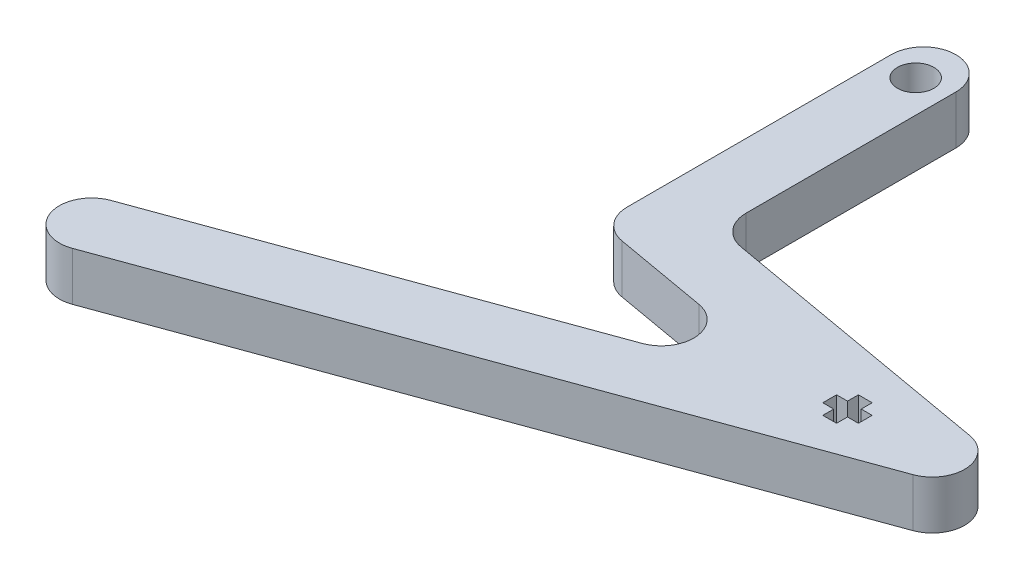
from build123d import *

# Parameters (mm, degrees)
SKETCH1_R           = 2.25
BOSS_EXTRUDE1_DEPTH = 6
FILLET1_R           = 4


with BuildPart() as part:
    # Sketch1 → Boss-Extrude1 (new body)
    with BuildSketch(Plane(origin=(0, 0, 0), x_dir=(1, 0, 0), z_dir=(0, 1, 0))):
        Polygon((-71.479040749, 49.048444694), (-71.479040749, 9.048444694), (-41.934808158, 3.838999364), (-107.848225403, -20.151522552), (-105.112064256, -27.669063518), (-11.142802178, 6.532950815), (-63.479040749, 15.761241744), (-63.479040749, 49.048444694), align=None)
        with Locations(Location((-67.479040749, 44.077475717, 0), (0, 0, 270))):
            Circle(SKETCH1_R, mode=Mode.SUBTRACT)
        Polygon((-38.433012349, 5.25170526), (-38.433012349, 3.55170526), (-37.083012349, 3.55170526), (-37.083012349, 2.20170526), (-35.383012349, 2.20170526), (-35.383012349, 3.55170526), (-34.033012349, 3.55170526), (-34.033012349, 5.25170526), (-35.383012349, 5.25170526), (-35.383012349, 6.60170526), (-37.083012349, 6.60170526), (-37.083012349, 5.25170526), align=None, mode=Mode.SUBTRACT)
    extrude(amount=BOSS_EXTRUDE1_DEPTH)

    # Fillet1
    fillet1_edges = [part.edges().sort_by_distance(p)[0] for p in [
        (-63.479040749, 3, -15.761241744),
        (-71.479040749, 3, -9.048444694),
        (-105.112064256, 3, 27.669063518),
        (-107.848225403, 3, 20.151522552),
        (-41.934808158, 3, -3.838999364),
        (-11.142802178, 3, -6.532950815),
        (-63.479040749, 3, -49.048444694),
        (-71.479040749, 3, -49.048444694),
    ]]
    fillet(fillet1_edges, radius=FILLET1_R - 0.0001)  # a hair under: the kernel refuses the full size


solid = part.part
